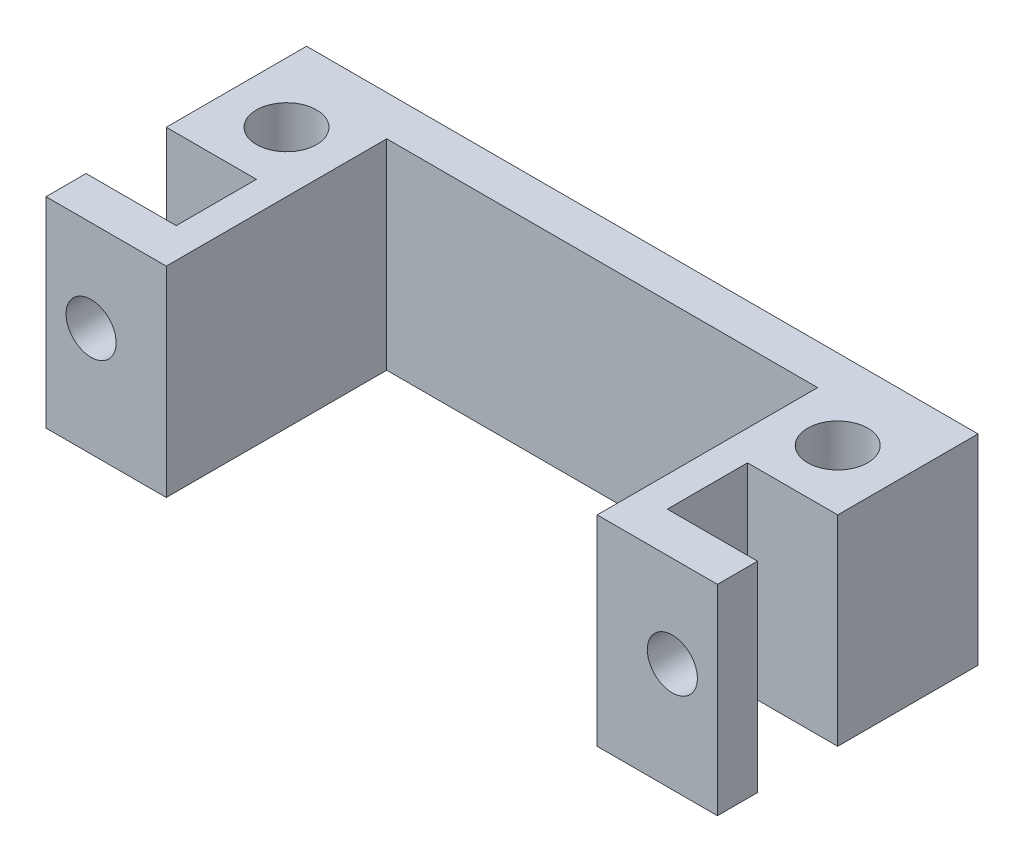
from build123d import *

# Parameters (mm, degrees)
BOSS_EXTRUDE1_DEPTH             = 25.4
SKETCH2_R                       = 3.81
CUT_EXTRUDE1_DEPTH              = 95.74063806
F_1_4_0_25_DIAMETER_HOLE1_D     = 6.35
F_1_4_0_25_DIAMETER_HOLE1_DEPTH = 7.62
F_1_4_0_25_DIAMETER_HOLE1_TIP   = 1.907732465
F_1_4_0_25_DIAMETER_HOLE2_D     = 6.35
F_1_4_0_25_DIAMETER_HOLE2_DEPTH = 10.16
F_1_4_0_25_DIAMETER_HOLE2_TIP   = 1.907732465


with BuildPart() as part:
    # Sketch1 → Boss-Extrude1 (new body)
    with BuildSketch(Plane(origin=(0, 0, 0), x_dir=(1, 0, 0), z_dir=(0, 1, 0))):
        Polygon((69.85, 0), (85.09, 0), (85.09, 5.08), (73.66, 5.08), (73.66, 15.24), (85.09, 15.24), (85.09, 33.02), (0, 33.02), (0, 15.24), (11.43, 15.24), (11.43, 5.08), (0, 5.08), (0, 0), (15.24, 0), (15.24, 27.94), (69.85, 27.94), align=None)
    extrude(amount=BOSS_EXTRUDE1_DEPTH)

    # Sketch2 → Cut-Extrude1 (cut, through all)
    with BuildSketch(Plane(origin=(0, 25.4, 0), x_dir=(1, 0, 0), z_dir=(0, 1, 0))):
        with Locations((7.62, 22.86)):
            Circle(SKETCH2_R)
        with Locations((77.47, 22.86)):
            Circle(SKETCH2_R)
    extrude(amount=-CUT_EXTRUDE1_DEPTH, mode=Mode.SUBTRACT)

    # 1/4 (0.25) Diameter Hole1
    with Locations(Plane.XY):
        with Locations((5.715, 13.802822473), (79.375, 13.802822473)):
            Hole(F_1_4_0_25_DIAMETER_HOLE1_D / 2, depth=F_1_4_0_25_DIAMETER_HOLE1_DEPTH)
            with Locations((0, 0, -(F_1_4_0_25_DIAMETER_HOLE1_DEPTH + F_1_4_0_25_DIAMETER_HOLE1_TIP / 2))):  # 118° drill point
                Cone(0, F_1_4_0_25_DIAMETER_HOLE1_D / 2, F_1_4_0_25_DIAMETER_HOLE1_TIP, mode=Mode.SUBTRACT)

    # 1/4 (0.25) Diameter Hole2
    with Locations(Plane(origin=(0, 0, -33.02), x_dir=(-1, 0, 0), z_dir=(0, 0, -1))):
        with Locations((-77.47, 12.7), (-7.62, 12.7)):
            Hole(F_1_4_0_25_DIAMETER_HOLE2_D / 2, depth=F_1_4_0_25_DIAMETER_HOLE2_DEPTH)
            with Locations((0, 0, -(F_1_4_0_25_DIAMETER_HOLE2_DEPTH + F_1_4_0_25_DIAMETER_HOLE2_TIP / 2))):  # 118° drill point
                Cone(0, F_1_4_0_25_DIAMETER_HOLE2_D / 2, F_1_4_0_25_DIAMETER_HOLE2_TIP, mode=Mode.SUBTRACT)


solid = part.part
